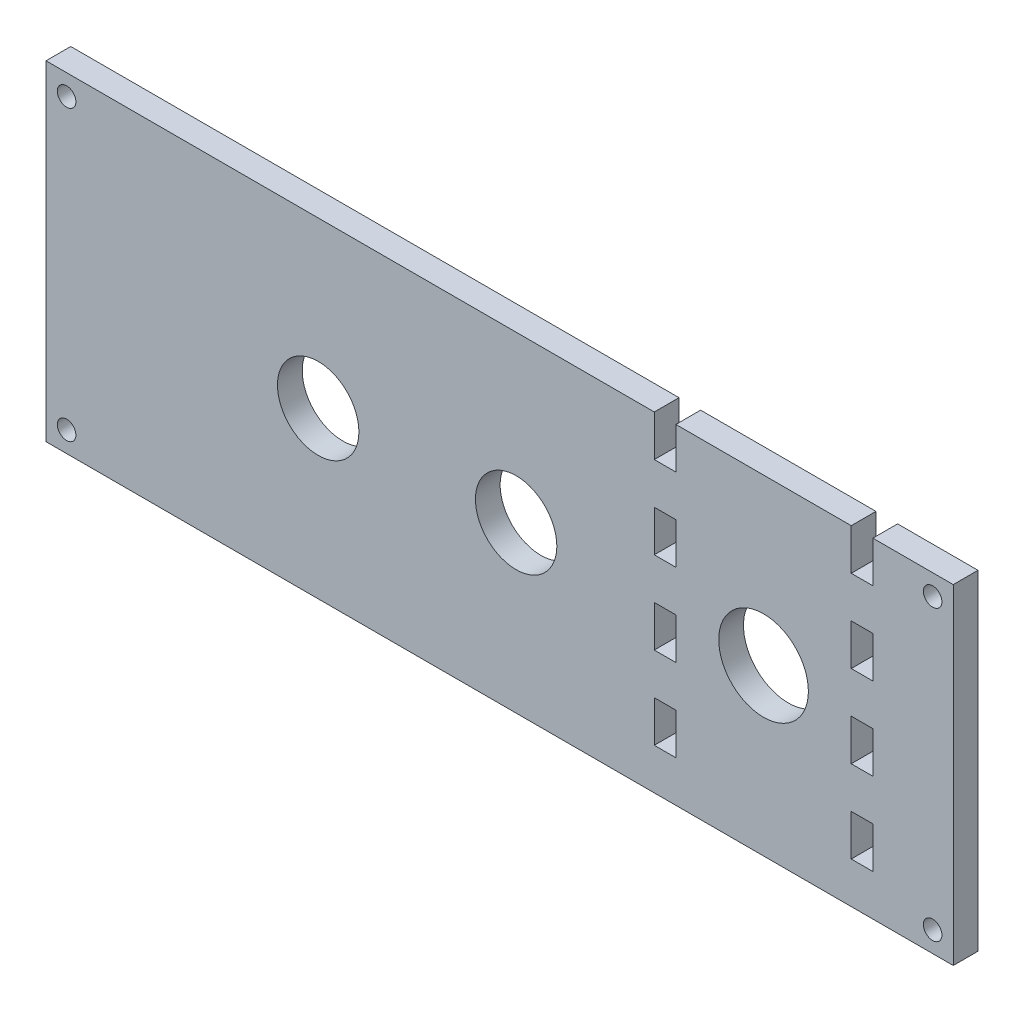
from build123d import *

# Parameters (mm, degrees)
SKETCH1_W           = 110
SKETCH1_H           = 40
BOSS_EXTRUDE1_DEPTH = 3
SKETCH2_W           = 2.62
SKETCH2_H           = 5
SKETCH2_R           = 4.9365
SKETCH2_R_2         = 1.125
SKETCH2_R_3         = 5.435
CUT_EXTRUDE1_DEPTH  = 118.08543889


with BuildPart() as part:
    # Sketch1 → Boss-Extrude1 (new body)
    with BuildSketch(Plane.XY):
        with Locations((55, 20)):
            Rectangle(SKETCH1_W, SKETCH1_H)
    extrude(amount=BOSS_EXTRUDE1_DEPTH)

    # Sketch2 → Cut-Extrude1 (cut, through all)
    with BuildSketch(Plane.XY.offset(3)):
        with Locations((98.94, 37.5)):
            Rectangle(SKETCH2_W, SKETCH2_H)
        with Locations((75.06, 37.5)):
            Rectangle(SKETCH2_W, SKETCH2_H)
        with Locations((75.06, 27.5)):
            Rectangle(SKETCH2_W, SKETCH2_H)
        with Locations((75.06, 17.5)):
            Rectangle(SKETCH2_W, SKETCH2_H)
        with Locations((75.06, 7.5)):
            Rectangle(SKETCH2_W, SKETCH2_H)
        with Locations((98.94, 27.5)):
            Rectangle(SKETCH2_W, SKETCH2_H)
        with Locations((98.94, 17.5)):
            Rectangle(SKETCH2_W, SKETCH2_H)
        with Locations((98.94, 7.5)):
            Rectangle(SKETCH2_W, SKETCH2_H)
        with Locations((33, 20)):
            Circle(SKETCH2_R)
        with Locations((57, 20)):
            Circle(SKETCH2_R)
        with Locations((2.5, 37.5)):
            Circle(SKETCH2_R_2)
        with Locations((107.5, 37.5)):
            Circle(SKETCH2_R_2)
        with Locations((107.5, 2.5)):
            Circle(SKETCH2_R_2)
        with Locations((2.5, 2.5)):
            Circle(SKETCH2_R_2)
        with Locations((87, 20)):
            Circle(SKETCH2_R_3)
    extrude(amount=-CUT_EXTRUDE1_DEPTH, mode=Mode.SUBTRACT)


solid = part.part
